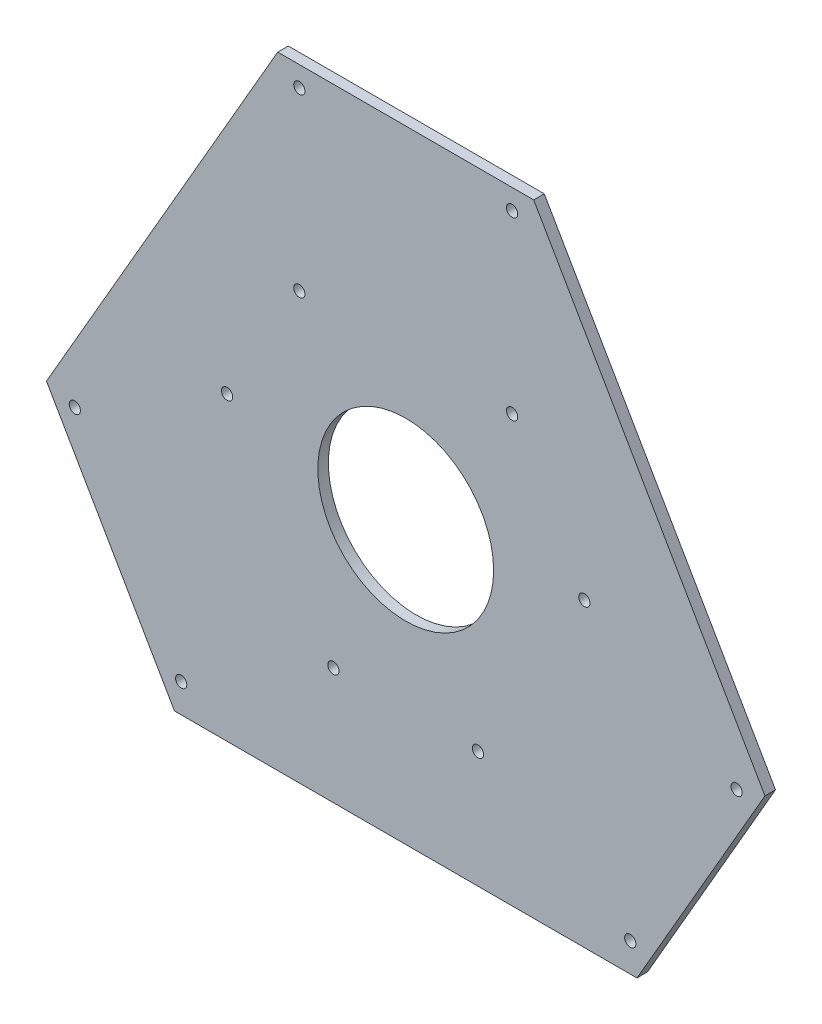
from build123d import *

# Parameters (mm, degrees)
SKETCH_1_R      = 1.6
SKETCH_1_R_2    = 25
EXTRUDE_1_DEPTH = 3


with BuildPart() as part:
    # ｽｹｯﾁ1 → ﾎﾞｽ - 押し出し1 (new body)
    with BuildSketch(Plane.XY):
        Polygon((36.39879245, 96.955442142), (-36.39879245, 96.955442142), (-102.165272155, -16.955442142), (-65.766479705, -80), (65.766479705, -80), (102.165272155, -16.955442142), align=None)
        with Locations((-63.852618114, -71.795017542)):
            Circle(SKETCH_1_R, mode=Mode.SUBTRACT)
        with Locations((-20.551347925, -46.795017542)):
            Circle(SKETCH_1_R, mode=Mode.SUBTRACT)
        with Locations((-94.102618114, -19.400480613)):
            Circle(SKETCH_1_R, mode=Mode.SUBTRACT)
        with Locations((-50.801347925, 5.599519387)):
            Circle(SKETCH_1_R, mode=Mode.SUBTRACT)
        Circle(SKETCH_1_R_2, mode=Mode.SUBTRACT)
        with Locations((20.551347925, -46.795017542)):
            Circle(SKETCH_1_R, mode=Mode.SUBTRACT)
        with Locations((63.852618114, -71.795017542)):
            Circle(SKETCH_1_R, mode=Mode.SUBTRACT)
        with Locations((50.801347925, 5.599519387)):
            Circle(SKETCH_1_R, mode=Mode.SUBTRACT)
        with Locations((94.102618114, -19.400480613)):
            Circle(SKETCH_1_R, mode=Mode.SUBTRACT)
        with Locations((-30.25, 41.195498156)):
            Circle(SKETCH_1_R, mode=Mode.SUBTRACT)
        with Locations((-30.25, 91.195498156)):
            Circle(SKETCH_1_R, mode=Mode.SUBTRACT)
        with Locations((30.25, 41.195498156)):
            Circle(SKETCH_1_R, mode=Mode.SUBTRACT)
        with Locations((30.25, 91.195498156)):
            Circle(SKETCH_1_R, mode=Mode.SUBTRACT)
    extrude(amount=EXTRUDE_1_DEPTH)


solid = part.part
